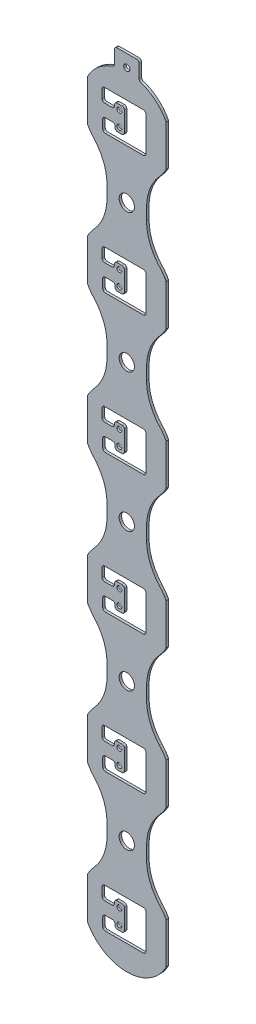
from build123d import *

# Parameters (mm, degrees)
BOSS_EXTRU_1_DEPTH               = 0.508
R_P_TITION_LIN_AIRE1_COUNT       = 6
R_P_TITION_LIN_AIRE1_PITCH       = 28
ENL_V_MAT_EXTRU_1_DEPTH          = 169.24166566
ENL_V_MAT_EXTRU_2_DEPTH          = 150.272429015
CONG_1_R                         = 0.5
ESQUISSE4_R                      = 0.5
ENL_V_MAT_EXTRU_3_DEPTH          = 0.2
ESQUISSE5_R                      = 0.6
BOSS_EXTRU_2_DEPTH               = 0.2
CONG_2_R                         = 0.2
R_P_TITION_LIN_AIRE2_COUNT       = 6
R_P_TITION_LIN_AIRE2_PITCH       = 28
CONG_1_OF_R_P_TITION_LIN_AIRE2_R = 0.5
CONG_2_OF_R_P_TITION_LIN_AIRE2_R = 0.2
CONG_4_R                         = 10
ESQUISSE6_OUTSIDE_W              = 51.804
ESQUISSE6_OUTSIDE_H              = 191.804
ESQUISSE6_OUTSIDE_W_2            = 15.988284163
ESQUISSE6_OUTSIDE_H_2            = 177.013714553
ENL_V_MAT_EXTRU_4_DEPTH          = 150.273243631
ESQUISSE7_R                      = 1.55
ENL_V_MAT_EXTRU_5_DEPTH          = 150.21629021
ESQUISSE8_W                      = 5
ESQUISSE8_H                      = 5
ESQUISSE8_R                      = 0.625
BOSS_EXTRU_3_DEPTH               = 0.508
CONG_5_R                         = 0.5
ESQUISSE9_W                      = 2.5
ESQUISSE9_H                      = 2.75
ENL_V_MAT_EXTRU_6_DEPTH          = 150.21629021
R_P_TITION_LIN_AIRE3_COUNT       = 6
R_P_TITION_LIN_AIRE3_PITCH       = 28
CONG_6_R                         = 0.5
CONG_7_R                         = 0.5


with BuildPart() as part:
    # Esquisse1 → Boss.-Extru.1 (new body)
    with BuildSketch(Plane.XY):
        with BuildLine():
            Line((4, -28), (-4, -28))
            Line((-4, -28), (-4, -8.062257748))
            ThreePointArc((-4, -8.062257748), (0, 9), (4, -8.062257748))
            Line((4, -8.062257748), (4, -28))
        make_face()
    boss_extru_1 = extrude(amount=BOSS_EXTRU_1_DEPTH)

    # Répétition linéaire1: Boss.-Extru.1 ×6
    with Locations(*[(0, -i * R_P_TITION_LIN_AIRE1_PITCH, 0) for i in range(1, R_P_TITION_LIN_AIRE1_COUNT)]):
        add(boss_extru_1)

    # Esquisse2 → Enlèv. mat.-Extru.1 (cut, through all)
    with BuildSketch(Plane.XY.offset(0.508)):
        with BuildLine():
            Line((-4, -168), (-4, -148.062257748))
            ThreePointArc((-4, -148.062257748), (0, -149), (4, -148.062257748))
            Line((4, -148.062257748), (4, -168))
            Line((4, -168), (-4, -168))
        make_face()
    enl_v_mat_extru_1 = extrude(amount=-ENL_V_MAT_EXTRU_1_DEPTH, mode=Mode.SUBTRACT)

    # Esquisse3 → Enlèv. mat.-Extru.2 (cut, through all)
    with BuildSketch(Plane.XY.offset(0.508)):
        Polygon((-3.875, 2.5), (-3.875, 4), (3.875, 4), (3.875, -4), (-3.875, -4), (-3.875, -2.5), (-0.5, -2.5), (-0.5, 2.5), align=None)
    enl_v_mat_extru_2 = extrude(amount=-ENL_V_MAT_EXTRU_2_DEPTH, mode=Mode.SUBTRACT)

    # Congé1
    cong_1_edges = [part.edges().sort_by_distance(p)[0] for p in [
        (3.875, 4, 0.254),
        (3.875, -4, 0.254),
        (-3.875, -4, 0.254),
        (-3.875, -2.5, 0.254),
        (-0.5, -2.5, 0.254),
        (-0.5, 2.5, 0.254),
        (-3.875, 2.5, 0.254),
        (-3.875, 4, 0.254),
    ]]
    fillet(cong_1_edges, radius=CONG_1_R)

    # Esquisse4 → Enlèv. mat.-Extru.3 (cut)
    with BuildSketch(Plane.XY.offset(0.508)):
        with Locations((-1.5, 1.5)):
            Circle(ESQUISSE4_R)
        with Locations((-1.5, -1.5)):
            Circle(ESQUISSE4_R)
    enl_v_mat_extru_3 = extrude(amount=-ENL_V_MAT_EXTRU_3_DEPTH, mode=Mode.SUBTRACT)

    # Esquisse5 → Boss.-Extru.2 (add)
    with BuildSketch(Plane(origin=(0, 0, 0), x_dir=(-1, 0, 0), z_dir=(0, 0, -1))):
        with Locations(Location((1.5, 1.5, 0), (0, 0, 180))):
            Circle(ESQUISSE5_R)
        with Locations(Location((1.5, -1.5, 0), (0, 0, 180))):
            Circle(ESQUISSE5_R)
    boss_extru_2 = extrude(amount=BOSS_EXTRU_2_DEPTH)

    # Congé2
    cong_2_edges = [part.edges().sort_by_distance(p)[0] for p in [
        (-2, 1.5, 0.308),
        (-2, -1.5, 0.308),
        (-2.1, 1.5, -0.2),
        (-2.1, -1.5, -0.2),
    ]]
    fillet(cong_2_edges, radius=CONG_2_R - 0.0001)  # a hair under: the kernel refuses the full size

    # Répétition linéaire2: Enlèv. mat.-Extru.1, Enlèv. mat.-Extru.2, Enlèv. mat.-Extru.3, Boss.-Extru.2 ×6
    with Locations(*[(0, -i * R_P_TITION_LIN_AIRE2_PITCH, 0) for i in range(1, R_P_TITION_LIN_AIRE2_COUNT)]):
        add(enl_v_mat_extru_1, mode=Mode.SUBTRACT)
        add(enl_v_mat_extru_2, mode=Mode.SUBTRACT)
        add(enl_v_mat_extru_3, mode=Mode.SUBTRACT)
        add(boss_extru_2)

    # Congé1 of Répétition linéaire2
    cong_1_of_r_p_tition_lin_aire2_edges = [part.edges().sort_by_distance(p)[0] for p in [
        (3.875, -24, 0.254),
        (3.875, -32, 0.254),
        (-3.875, -32, 0.254),
        (-3.875, -30.5, 0.254),
        (-0.5, -30.5, 0.254),
        (-0.5, -25.5, 0.254),
        (-3.875, -25.5, 0.254),
        (-3.875, -24, 0.254),
        (3.875, -52, 0.254),
        (3.875, -60, 0.254),
        (-3.875, -60, 0.254),
        (-3.875, -58.5, 0.254),
        (-0.5, -58.5, 0.254),
        (-0.5, -53.5, 0.254),
        (-3.875, -53.5, 0.254),
        (-3.875, -52, 0.254),
        (3.875, -80, 0.254),
        (3.875, -88, 0.254),
        (-3.875, -88, 0.254),
        (-3.875, -86.5, 0.254),
        (-0.5, -86.5, 0.254),
        (-0.5, -81.5, 0.254),
        (-3.875, -81.5, 0.254),
        (-3.875, -80, 0.254),
        (3.875, -108, 0.254),
        (3.875, -116, 0.254),
        (-3.875, -116, 0.254),
        (-3.875, -114.5, 0.254),
        (-0.5, -114.5, 0.254),
        (-0.5, -109.5, 0.254),
        (-3.875, -109.5, 0.254),
        (-3.875, -108, 0.254),
        (3.875, -136, 0.254),
        (3.875, -144, 0.254),
        (-3.875, -144, 0.254),
        (-3.875, -142.5, 0.254),
        (-0.5, -142.5, 0.254),
        (-0.5, -137.5, 0.254),
        (-3.875, -137.5, 0.254),
        (-3.875, -136, 0.254),
    ]]
    fillet(cong_1_of_r_p_tition_lin_aire2_edges, radius=CONG_1_OF_R_P_TITION_LIN_AIRE2_R)

    # Congé2 of Répétition linéaire2
    cong_2_of_r_p_tition_lin_aire2_edges = [part.edges().sort_by_distance(p)[0] for p in [
        (-2, -26.5, 0.308),
        (-2, -29.5, 0.308),
        (-2.1, -26.5, -0.2),
        (-2.1, -29.5, -0.2),
        (-2, -54.5, 0.308),
        (-2, -57.5, 0.308),
        (-2.1, -54.5, -0.2),
        (-2.1, -57.5, -0.2),
        (-2, -82.5, 0.308),
        (-2, -85.5, 0.308),
        (-2.1, -82.5, -0.2),
        (-2.1, -85.5, -0.2),
        (-2, -110.5, 0.308),
        (-2, -113.5, 0.308),
        (-2.1, -110.5, -0.2),
        (-2.1, -113.5, -0.2),
        (-2, -138.5, 0.308),
        (-2, -141.5, 0.308),
        (-2.1, -138.5, -0.2),
        (-2.1, -141.5, -0.2),
    ]]
    fillet(cong_2_of_r_p_tition_lin_aire2_edges, radius=CONG_2_OF_R_P_TITION_LIN_AIRE2_R - 0.0001)  # a hair under: the kernel refuses the full size

    # Congé4
    cong_4_edges = [part.edges().sort_by_distance(p)[0] for p in [
        (4, -19.937742252, 0.254),
        (4, -36.062257748, 0.254),
        (-4, -19.937742252, 0.254),
        (-4, -47.937742252, 0.254),
        (-4, -36.062257748, 0.254),
        (4, -47.937742252, 0.254),
        (4, -64.062257748, 0.254),
        (-4, -75.937742252, 0.254),
        (-4, -64.062257748, 0.254),
        (4, -75.937742252, 0.254),
        (4, -92.062257748, 0.254),
        (-4, -103.937742252, 0.254),
        (-4, -92.062257748, 0.254),
        (4, -103.937742252, 0.254),
        (4, -120.062257748, 0.254),
        (-4, -131.937742252, 0.254),
        (-4, -120.062257748, 0.254),
        (4, -131.937742252, 0.254),
        (-4, -8.062257748, 0.254),
        (4, -8.062257748, 0.254),
    ]]
    fillet(cong_4_edges, radius=CONG_4_R)

    # Esquisse6 outside → Enlèv. mat.-Extru.4 (cut, through all)
    with BuildSketch(Plane.XY.offset(0.508)):
        with Locations((0, -70)):
            Rectangle(ESQUISSE6_OUTSIDE_W, ESQUISSE6_OUTSIDE_H)
        with Locations((-0.005857918, -78.196190373)):
            Rectangle(ESQUISSE6_OUTSIDE_W_2, ESQUISSE6_OUTSIDE_H_2, mode=Mode.SUBTRACT)
    extrude(amount=-ENL_V_MAT_EXTRU_4_DEPTH, mode=Mode.SUBTRACT)

    # Esquisse7 → Enlèv. mat.-Extru.5 (cut, through all)
    with BuildSketch(Plane.XY.offset(0.508)):
        with Locations((0, -14)):
            Circle(ESQUISSE7_R)
        with Locations((0, -42)):
            Circle(ESQUISSE7_R)
        with Locations((0, -70)):
            Circle(ESQUISSE7_R)
        with Locations((0, -98)):
            Circle(ESQUISSE7_R)
        with Locations((0, -126)):
            Circle(ESQUISSE7_R)
    extrude(amount=-ENL_V_MAT_EXTRU_5_DEPTH, mode=Mode.SUBTRACT)

    # Esquisse8 → Boss.-Extru.3 (add)
    with BuildSketch(Plane.XY.offset(0.508)):
        with Locations((0, 9.7)):
            Rectangle(ESQUISSE8_W, ESQUISSE8_H)
        with Locations((0, 9.7)):
            Circle(ESQUISSE8_R, mode=Mode.SUBTRACT)
    extrude(amount=-BOSS_EXTRU_3_DEPTH)

    # Congé5
    cong_5_edges = [part.edges().sort_by_distance(p)[0] for p in [
        (2.5, 12.2, 0.254),
        (-2.5, 12.2, 0.254),
        (-2.5, 8.645808233, 0.254),
        (2.5, 8.645808233, 0.254),
    ]]
    fillet(cong_5_edges, radius=CONG_5_R)

    # Esquisse9 → Enlèv. mat.-Extru.6 (cut, through all)
    with BuildSketch(Plane.XY.offset(0.508)):
        with Locations((-3.75, 2.625)):
            Rectangle(ESQUISSE9_W, ESQUISSE9_H)
        with Locations((-3.625, -2.625)):
            Rectangle(ESQUISSE9_W, ESQUISSE9_H)
    enl_v_mat_extru_6 = extrude(amount=-ENL_V_MAT_EXTRU_6_DEPTH, mode=Mode.SUBTRACT)

    # Répétition linéaire3: Enlèv. mat.-Extru.6 ×6
    with Locations(*[(0, -i * R_P_TITION_LIN_AIRE3_PITCH, 0) for i in range(1, R_P_TITION_LIN_AIRE3_COUNT)]):
        add(enl_v_mat_extru_6, mode=Mode.SUBTRACT)

    # Congé6
    cong_6_edges = [part.edges().sort_by_distance(p)[0] for p in [
        (-2.375, -2.5, 0.254),
        (-5, 1.25, 0.254),
        (-2.5, 1.25, 0.254),
        (-2.5, 2.5, 0.254),
        (-5, 4, 0.254),
        (-4.875, -4, 0.254),
        (-4.875, -1.25, 0.254),
        (-2.375, -1.25, 0.254),
    ]]
    fillet(cong_6_edges, radius=CONG_6_R)

    # Congé7
    cong_7_edges = [part.edges().sort_by_distance(p)[0] for p in [
        (-2.375, -30.5, 0.254),
        (-2.375, -58.5, 0.254),
        (-2.375, -86.5, 0.254),
        (-2.375, -114.5, 0.254),
        (-2.375, -142.5, 0.254),
        (-5, -26.75, 0.254),
        (-2.5, -26.75, 0.254),
        (-2.5, -25.5, 0.254),
        (-5, -24, 0.254),
        (-4.875, -32, 0.254),
        (-4.875, -29.25, 0.254),
        (-2.375, -29.25, 0.254),
        (-5, -54.75, 0.254),
        (-2.5, -54.75, 0.254),
        (-2.5, -53.5, 0.254),
        (-5, -52, 0.254),
        (-4.875, -60, 0.254),
        (-4.875, -57.25, 0.254),
        (-2.375, -57.25, 0.254),
        (-5, -82.75, 0.254),
        (-2.5, -82.75, 0.254),
        (-2.5, -81.5, 0.254),
        (-5, -80, 0.254),
        (-4.875, -88, 0.254),
        (-4.875, -85.25, 0.254),
        (-2.375, -85.25, 0.254),
        (-5, -110.75, 0.254),
        (-2.5, -110.75, 0.254),
        (-2.5, -109.5, 0.254),
        (-5, -108, 0.254),
        (-4.875, -116, 0.254),
        (-4.875, -113.25, 0.254),
        (-2.375, -113.25, 0.254),
        (-5, -138.75, 0.254),
        (-2.5, -138.75, 0.254),
        (-2.5, -137.5, 0.254),
        (-5, -136, 0.254),
        (-4.875, -144, 0.254),
        (-4.875, -141.25, 0.254),
        (-2.375, -141.25, 0.254),
    ]]
    fillet(cong_7_edges, radius=CONG_7_R)


solid = part.part
